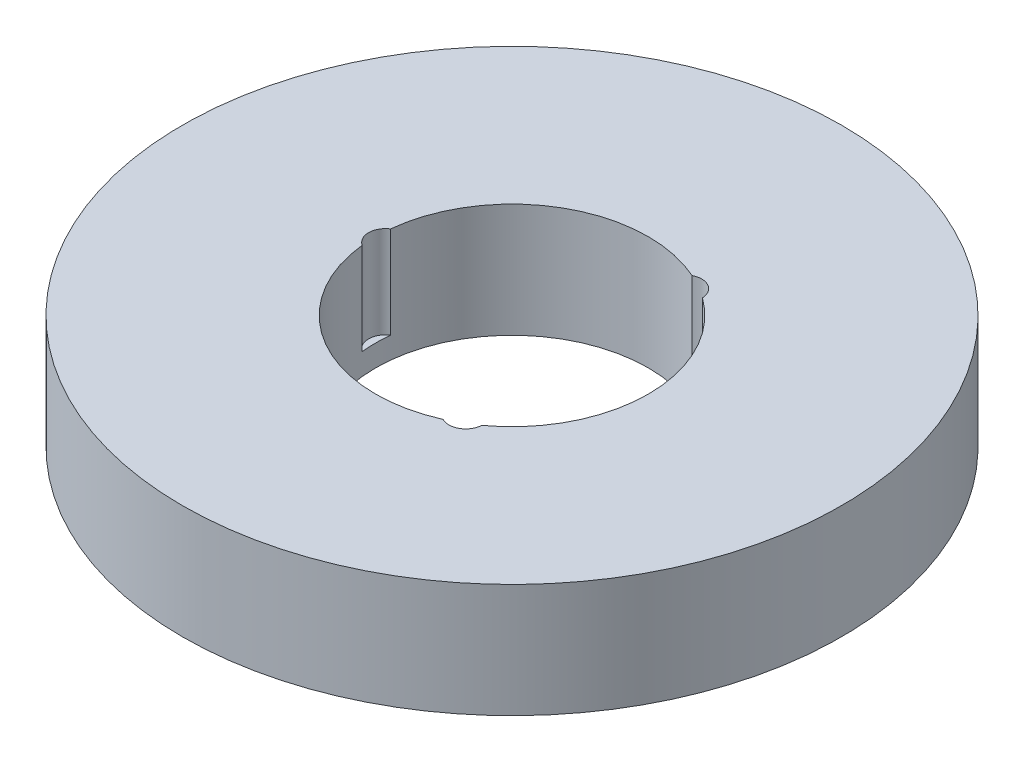
from build123d import *

# Parameters (mm, degrees)
SKETCH1_R           = 72.5
BOSS_EXTRUDE1_DEPTH = 25
SKETCH2_R           = 30
CUT_EXTRUDE1_DEPTH  = 106.534354596
SKETCH3_R           = 3.698479856
CUT_EXTRUDE2_DEPTH  = 20.247976071
CIRPATTERN1_COUNT   = 3


with BuildPart() as part:
    # Sketch1 → Boss-Extrude1 (new body)
    with BuildSketch(Plane(origin=(0, 0, 0), x_dir=(1, 0, 0), z_dir=(0, 1, 0))):
        Circle(SKETCH1_R)
    extrude(amount=BOSS_EXTRUDE1_DEPTH)

    # Sketch2 → Cut-Extrude1 (cut, through all)
    with BuildSketch(Plane(origin=(0, 0, 0), x_dir=(1, 0, 0), z_dir=(0, 1, 0))):
        Circle(SKETCH2_R)
    extrude(amount=CUT_EXTRUDE1_DEPTH, mode=Mode.SUBTRACT)

    # Sketch3 → Cut-Extrude2 (cut)
    with BuildSketch(Plane(origin=(0, 25, 0), x_dir=(1, 0, 0), z_dir=(0, 1, 0))):
        with Locations((-27.842649971, 0)):
            Circle(SKETCH3_R)
    cut_extrude2 = extrude(amount=-CUT_EXTRUDE2_DEPTH, mode=Mode.SUBTRACT)

    # CirPattern1: Cut-Extrude2 ×3 about axis
    cirpattern1_axis = Axis((0, 0, 0), (0, 1, 0))
    for i in range(1, CIRPATTERN1_COUNT):
        add(cut_extrude2.rotate(cirpattern1_axis, i * 360 / CIRPATTERN1_COUNT), mode=Mode.SUBTRACT)


solid = part.part
